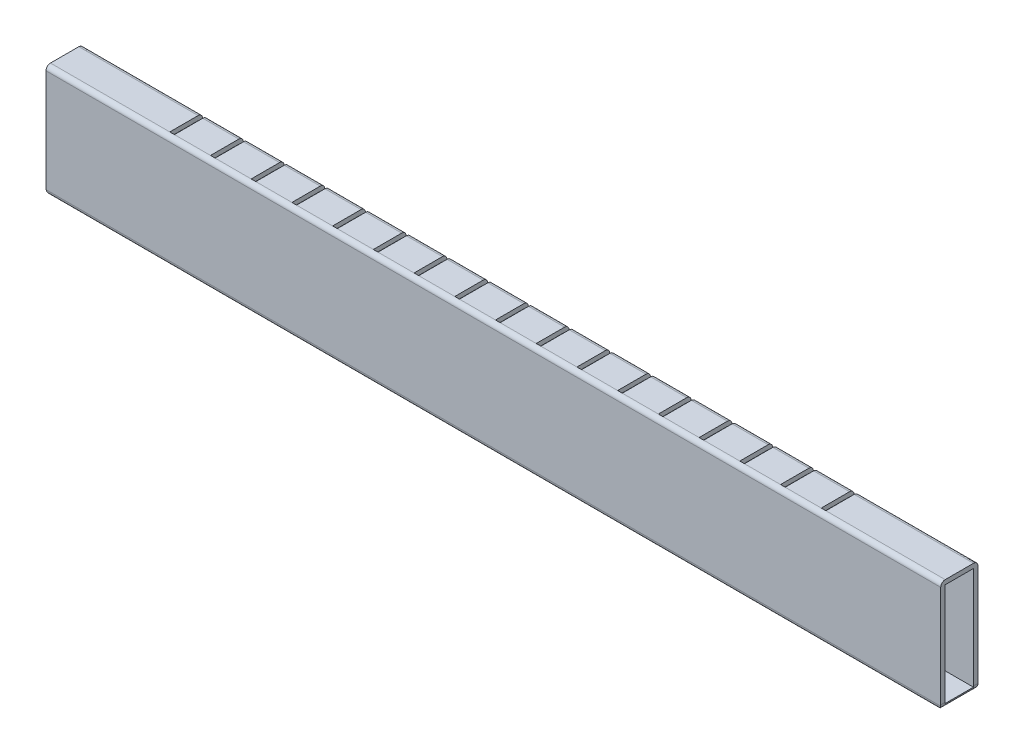
from build123d import *

# Parameters (mm, degrees)
SKETCH1_W           = 19.304
SKETCH1_H           = 70.104
BOSS_EXTRUDE1_DEPTH = 609.6
SKETCH2_W           = 3.175
SKETCH2_H           = 38.1
CUT_EXTRUDE1_DEPTH  = 38.1
LPATTERN1_COUNT     = 17
LPATTERN1_PITCH     = 27.74188
FILLET1_R           = 3.81
SKETCH4_R           = 2.625
CUT_EXTRUDE2_DEPTH  = 6.35
LPATTERN2_COUNT     = 2
LPATTERN2_PITCH     = 507.1999


with BuildPart() as part:
    # Sketch1 → Boss-Extrude1 (new body)
    with BuildSketch(Plane(origin=(0, 0, 0), x_dir=(0, 0, -1), z_dir=(1, 0, 0))):
        with BuildLine():
            Line((3.048, 0), (22.352, 0))
            ThreePointArc((22.352, 0), (24.507261469, 0.892738531), (25.4, 3.048))
            Line((25.4, 3.048), (25.4, 73.152))
            ThreePointArc((25.4, 73.152), (24.507261469, 75.307261469), (22.352, 76.2))
            Line((22.352, 76.2), (3.048, 76.2))
            ThreePointArc((3.048, 76.2), (0.892738531, 75.307261469), (0, 73.152))
            Line((0, 73.152), (0, 3.048))
            ThreePointArc((0, 3.048), (0.892738531, 0.892738531), (3.048, 0))
        make_face()
        with Locations((12.7, 38.1)):
            Rectangle(SKETCH1_W, SKETCH1_H, mode=Mode.SUBTRACT)
    extrude(amount=BOSS_EXTRUDE1_DEPTH)

    # Sketch2 → Cut-Extrude1 (cut)
    with BuildSketch(Plane(origin=(0, 76.2, 0), x_dir=(1, 0, 0), z_dir=(0, 1, 0))):
        with Locations((82.8675, 22.098)):
            Rectangle(SKETCH2_W, SKETCH2_H)
    cut_extrude1 = extrude(amount=-CUT_EXTRUDE1_DEPTH, mode=Mode.SUBTRACT)

    # LPattern1: Cut-Extrude1 ×17
    with Locations(*[(i * LPATTERN1_PITCH, 0, 0) for i in range(1, LPATTERN1_COUNT)]):
        add(cut_extrude1, mode=Mode.SUBTRACT)

    # Fillet1
    # the kernel refuses this fillet: 3.81 mm, written as the material it takes off along each edge
    with BuildSketch(Plane(origin=(609.6, 0, 6.477), x_dir=(0, 1, 0), z_dir=(0, 0, -1))) as fillet1_piece_1:
        with BuildLine():
            CenterArc((FILLET1_R, -FILLET1_R), FILLET1_R, 90, 90)
            Line((0, -FILLET1_R), (0, 0))
            Line((0, 0), (FILLET1_R, 0))
        make_face()
    extrude(amount=38.354, mode=Mode.SUBTRACT)
    with BuildSketch(Plane(origin=(0, 0, 6.477), x_dir=(0, 1, 0), z_dir=(0, 0, -1))) as fillet1_piece_2:
        with BuildLine():
            CenterArc((FILLET1_R, FILLET1_R), FILLET1_R, 180, 90)
            Line((0, FILLET1_R), (0, 0))
            Line((0, 0), (FILLET1_R, 0))
        make_face()
    extrude(amount=38.354, mode=Mode.SUBTRACT)

    # Sketch4 → Cut-Extrude2 (cut)
    with BuildSketch(Plane(origin=(0, 0, -25.4), x_dir=(-1, 0, 0), z_dir=(0, 0, -1))):
        with Locations((-578.4038, 62.073165047)):
            Circle(SKETCH4_R)
        with Locations((-538.4038, 62.073165047)):
            Circle(SKETCH4_R)
        with Locations((-540.0688, 15.723165047)):
            Circle(SKETCH4_R)
        with Locations((-576.3188, 15.723165047)):
            Circle(SKETCH4_R)
    cut_extrude2 = extrude(amount=-CUT_EXTRUDE2_DEPTH, mode=Mode.SUBTRACT)

    # LPattern2: Cut-Extrude2 ×2
    with Locations(*[(-i * LPATTERN2_PITCH, 0, 0) for i in range(1, LPATTERN2_COUNT)]):
        add(cut_extrude2, mode=Mode.SUBTRACT)


solid = part.part
